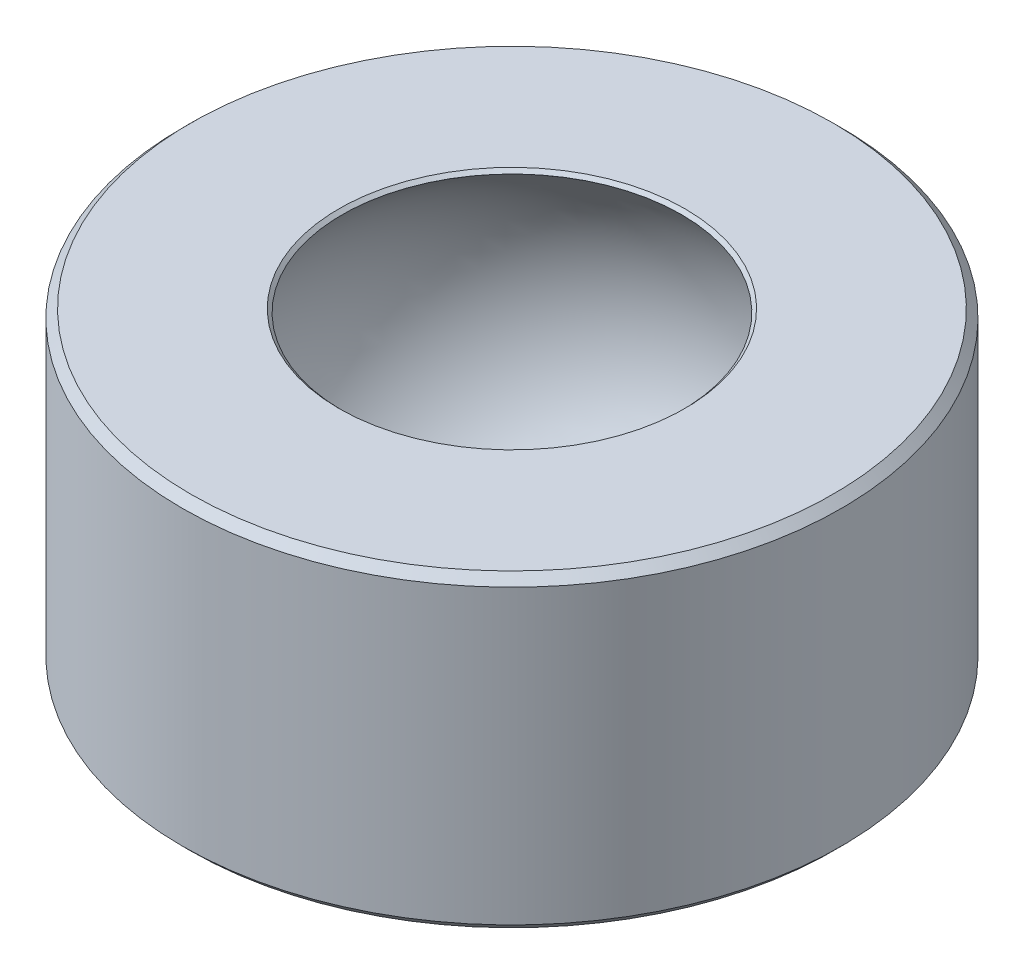
from build123d import *

# Parameters (mm, degrees)
BOSS_EXTRUDE1_DEPTH      = 1.875
BOSS_EXTRUDE1_DEPTH_BACK = 1.875
SKETCH1_R                = 4
SKETCH1_R_2              = 2
CHAMFER1_SIZE            = 0.072069825
CHAMFER1_SIZE_2          = 0.1


with BuildPart() as part:
    # Sketch1 → Boss-Extrude1 (new, two sides: drawn at the far end of the back side and taken through both)
    with BuildSketch(Plane(origin=(0, 0, 0), x_dir=(1, 0, 0), z_dir=(0, 1, 0)).offset(-BOSS_EXTRUDE1_DEPTH_BACK)):
        with Locations(Location((0, 0, 0), (0, 0, 270))):
            Circle(SKETCH1_R)
        with Locations(Location((0, 0, 0), (0, 0, 270))):
            Circle(SKETCH1_R_2, mode=Mode.SUBTRACT)
    extrude(amount=BOSS_EXTRUDE1_DEPTH + BOSS_EXTRUDE1_DEPTH_BACK)

    # Sketch3 → Cut-Revolve1 (revolve, cut)
    with BuildSketch(Plane(origin=(0, 0, 0), x_dir=(0, 0, -1), z_dir=(1, 0, 0))):
        with BuildLine():
            Line((-2, 1.875), (-2, -1.875))
            ThreePointArc((-2, -1.875), (-3, 0), (-2, 1.875))
        make_face()
    revolve(axis=Axis((0, 0, 0), (0, -1, 0)), mode=Mode.SUBTRACT)

    # Chamfer1
    # the kernel refuses this chamfer: 0.1, 0.072069825 mm, written as the material it takes off along each edge
    with BuildSketch(Plane(origin=(0, -1.875, 0), x_dir=(0, 0, 1), z_dir=(-1, 0, 0))) as chamfer1_piece_1:
        with BuildLine():
            Line((2 + CHAMFER1_SIZE * 1.00000000606, 0), (2.083679075, 0.058927964))
            ThreePointArc((2.083679075, 0.058927964), (2.043356425, 0.029823392), (2, 0))
            Line((2, 0), (2 + CHAMFER1_SIZE * 1.00000000606, 0))
        make_face()
    revolve(axis=Axis((0, -1.875, 0), (0, 1, 0)), mode=Mode.SUBTRACT)
    with BuildSketch(Plane(origin=(0, 1.875, 0), x_dir=(0, 0, 1), z_dir=(-1, 0, 0))) as chamfer1_piece_2:
        with BuildLine():
            Line((2 + CHAMFER1_SIZE_2, 0), (2.059026362, -0.040973638))
            ThreePointArc((2.059026362, -0.040973638), (2.029383998, -0.020049203), (2, 0))
            Line((2, 0), (2 + CHAMFER1_SIZE_2, 0))
        make_face()
    revolve(axis=Axis((0, 1.875, 0), (0, 1, 0)), mode=Mode.SUBTRACT)
    with BuildSketch(Plane(origin=(0, -1.875, 0), x_dir=(0, 0, 1), z_dir=(-1, 0, 0))) as chamfer1_piece_3:
        Polygon((4, CHAMFER1_SIZE_2), (4 - CHAMFER1_SIZE_2, 0), (4, 0), align=None)
    revolve(axis=Axis((0, -1.875, 0), (0, 1, 0)), mode=Mode.SUBTRACT)
    with BuildSketch(Plane(origin=(0, 1.875, 0), x_dir=(0, 0, 1), z_dir=(-1, 0, 0))) as chamfer1_piece_4:
        Polygon((4, -CHAMFER1_SIZE_2), (4 - CHAMFER1_SIZE_2, 0), (4, 0), align=None)
    revolve(axis=Axis((0, 1.875, 0), (0, 1, 0)), mode=Mode.SUBTRACT)


solid = part.part
